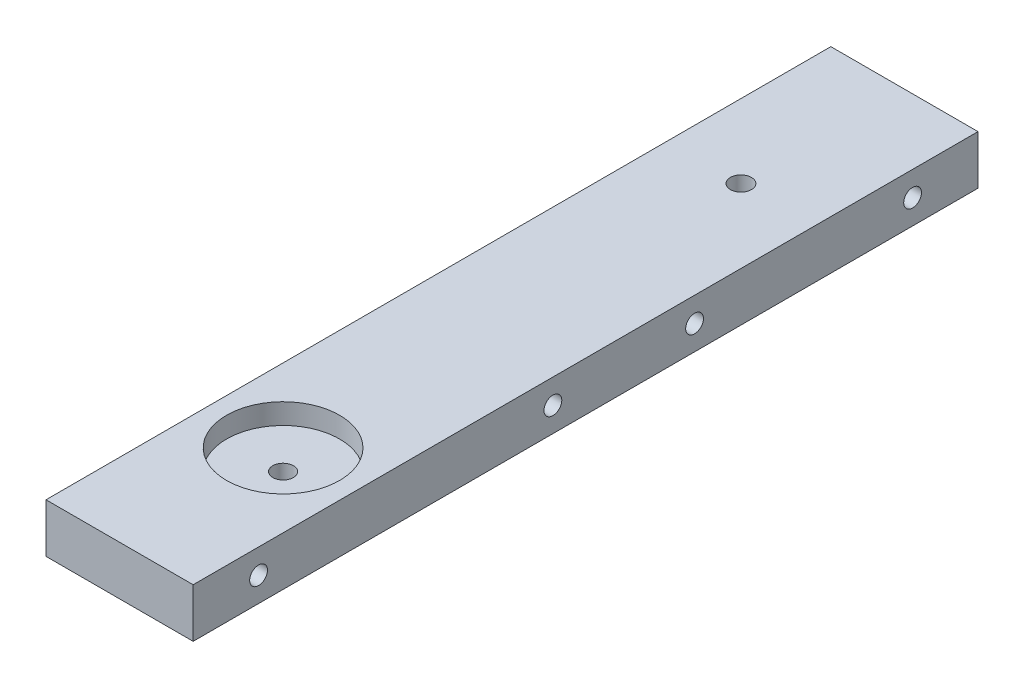
from build123d import *

# Parameters (mm, degrees)
SKETCH2_W             = 28.575
SKETCH2_H             = 152.4
BOSS_EXTRUDE1_DEPTH   = 9.525
F_5_CLEARANCE_HOLE3_D = 3.4544
LPATTERN1_COUNT       = 4
LPATTERN1_PITCH       = 42.333333333
F_5_CLEARANCE_HOLE5_D = 3.4544
SKETCH12_R            = 2.05
CUT_EXTRUDE1_DEPTH    = 156.348048749
SKETCH12_4_R          = 10.975
CUT_EXTRUDE2_DEPTH    = 4
SKETCH15_R            = 2
CUT_EXTRUDE3_DEPTH    = 156.154169296


with BuildPart() as part:
    # Sketch2 → Boss-Extrude1 (new body)
    with BuildSketch(Plane(origin=(0, 0, 0), x_dir=(1, 0, 0), z_dir=(0, 1, 0))):
        with Locations((14.2875, 76.2)):
            Rectangle(SKETCH2_W, SKETCH2_H)
    extrude(amount=BOSS_EXTRUDE1_DEPTH)

    # #5 Clearance Hole3 (through all)
    with Locations(Plane.ZY):
        with Locations((-139.7, 4.7625)):
            f_5_clearance_hole3 = Hole(F_5_CLEARANCE_HOLE3_D / 2)

    # LPattern1: #5 Clearance Hole3 ×4, 1 skipped
    with Locations(*[(0, 0, i * LPATTERN1_PITCH) for i in range(1, LPATTERN1_COUNT) if i not in (2,)]):
        add(f_5_clearance_hole3, mode=Mode.SUBTRACT)

    # #5 Clearance Hole5 (through all)
    with Locations(Plane.ZY):
        with Locations((-69.85, 4.7625)):
            Hole(F_5_CLEARANCE_HOLE5_D / 2)

    # Sketch12 → Cut-Extrude1 (cut, through all)
    with BuildSketch(Plane(origin=(0, 9.525, 0), x_dir=(1, 0, 0), z_dir=(0, 1, 0))):
        with Locations((14.2875, 120.65)):
            Circle(SKETCH12_R)
    extrude(amount=-CUT_EXTRUDE1_DEPTH, mode=Mode.SUBTRACT)

    # Sketch12<4> → Cut-Extrude2 (cut)
    with BuildSketch(Plane(origin=(0, 9.525, 0), x_dir=(1, 0, 0), z_dir=(0, 1, 0))):
        with Locations((14.2875, 31.75)):
            Circle(SKETCH12_4_R)
    extrude(amount=-CUT_EXTRUDE2_DEPTH, mode=Mode.SUBTRACT)

    # Sketch15 → Cut-Extrude3 (cut, through all)
    with BuildSketch(Plane(origin=(0, 5.525, 0), x_dir=(1, 0, 0), z_dir=(0, 1, 0))):
        with Locations((14.2875, 31.75)):
            Circle(SKETCH15_R)
    extrude(amount=-CUT_EXTRUDE3_DEPTH, mode=Mode.SUBTRACT)


solid = part.part
